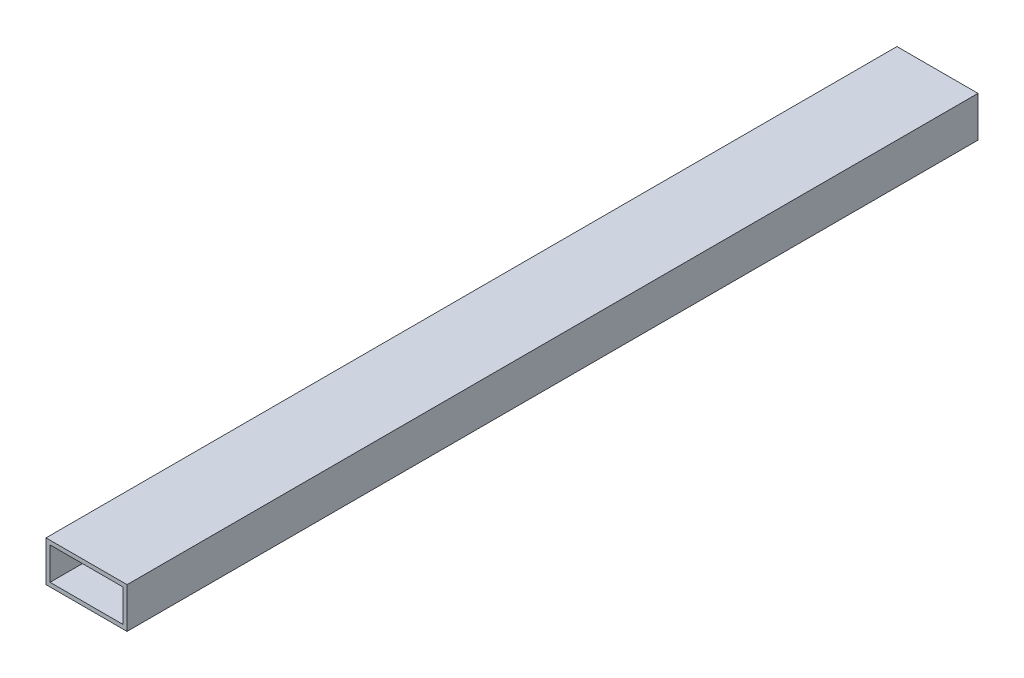
from build123d import *

# Parameters (mm, degrees)
SKETCH1_W           = 50.8
SKETCH1_H           = 25.4
SKETCH1_W_2         = 45.72
SKETCH1_H_2         = 20.32
BOSS_EXTRUDE1_DEPTH = 533.4


with BuildPart() as part:
    # Sketch1 → Boss-Extrude1 (new body)
    with BuildSketch(Plane.XY):
        Rectangle(SKETCH1_W, SKETCH1_H)
        Rectangle(SKETCH1_W_2, SKETCH1_H_2, mode=Mode.SUBTRACT)
    extrude(amount=-BOSS_EXTRUDE1_DEPTH)


solid = part.part
